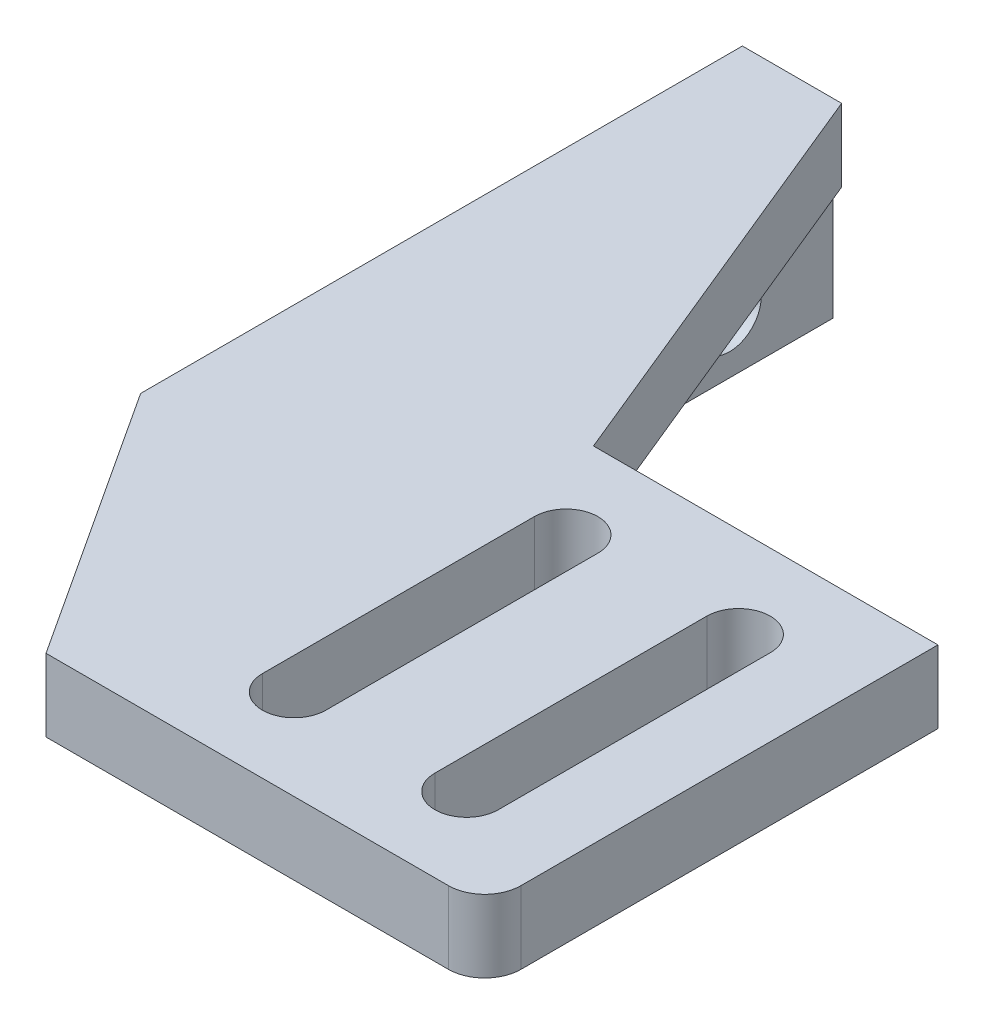
from build123d import *

# Parameters (mm, degrees)
ESTRUSIONE_ESTRUSIONE8_DEPTH = 4
SCHIZZO19_W                  = 5
SCHIZZO19_H                  = 48.212351189
ESTRUSIONE_ESTRUSIONE9_DEPTH = 6.5
SCHIZZO20_R                  = 1.75
TAGLIO_ESTRUSIONE9_DEPTH     = 6
TAGLIO_ESTRUSIONE13_DEPTH    = 21
SCHIZZO26_W                  = 5
SCHIZZO26_H                  = 6.5
TAGLIO_ESTRUSIONE15_DEPTH    = 21
RACCORDO1_R                  = 4
RACCORDO2_R                  = 2


with BuildPart() as part:
    # Schizzo18 → Estrusione-Estrusione8 (new body)
    with BuildSketch(Plane(origin=(0, 40, 0), x_dir=(1, 0, 0), z_dir=(0, 1, 0))):
        Polygon((25, -16), (-9, -16), (-9, 32.212351189), (-3.52472969, 32.212351189), (6, 9), (25, 9), align=None)
        with BuildLine():
            Line((17.25, -11), (17.25, 4))
            ThreePointArc((17.25, 4), (19, 5.75), (20.75, 4))
            Line((20.75, 4), (20.75, -11))
            ThreePointArc((20.75, -11), (19, -12.75), (17.25, -11))
        make_face(mode=Mode.SUBTRACT)
        with BuildLine():
            Line((7.74056589, -11), (7.74056589, 4))
            ThreePointArc((7.74056589, 4), (9.49056589, 5.75), (11.24056589, 4))
            Line((11.24056589, 4), (11.24056589, -11))
            ThreePointArc((11.24056589, -11), (9.49056589, -12.75), (7.74056589, -11))
        make_face(mode=Mode.SUBTRACT)
    extrude(amount=ESTRUSIONE_ESTRUSIONE8_DEPTH)

    # Schizzo19 → Estrusione-Estrusione9 (add)
    with BuildSketch(Plane.XZ.offset(-40)):
        with Locations((-6.5, -8.106175595)):
            Rectangle(SCHIZZO19_W, SCHIZZO19_H)
    extrude(amount=ESTRUSIONE_ESTRUSIONE9_DEPTH)

    # Schizzo20 → Taglio-Estrusione9 (cut)
    with BuildSketch(Plane.ZY.offset(9)):
        with Locations((-26.5, 36.5)):
            Circle(SCHIZZO20_R)
        with Locations((-16.5, 36.5)):
            Circle(SCHIZZO20_R)
    extrude(amount=-TAGLIO_ESTRUSIONE9_DEPTH, mode=Mode.SUBTRACT)

    # Schizzo24 → Taglio-Estrusione13 (cut)
    with BuildSketch(Plane(origin=(0, 44, 0), x_dir=(1, 0, 0), z_dir=(0, 1, 0))):
        Polygon((0.805132443, -16), (-9, -0.979024983), (-9, -16), align=None)
    extrude(amount=-TAGLIO_ESTRUSIONE13_DEPTH, mode=Mode.SUBTRACT)

    # Schizzo26 → Taglio-Estrusione15 (cut)
    with BuildSketch(Plane.XY.offset(0.979024983)):
        with Locations((-6.5, 36.75)):
            Rectangle(SCHIZZO26_W, SCHIZZO26_H)
    extrude(amount=TAGLIO_ESTRUSIONE15_DEPTH, mode=Mode.SUBTRACT)

    # Raccordo1
    raccordo1_edges = [part.edges().sort_by_distance(p)[0] for p in [
        (-6.5, 33.5, 0.979024983),
    ]]
    fillet(raccordo1_edges, radius=RACCORDO1_R)

    # Raccordo2
    raccordo2_edges = [part.edges().sort_by_distance(p)[0] for p in [
        (25, 42, 16),
    ]]
    fillet(raccordo2_edges, radius=RACCORDO2_R)


solid = part.part
